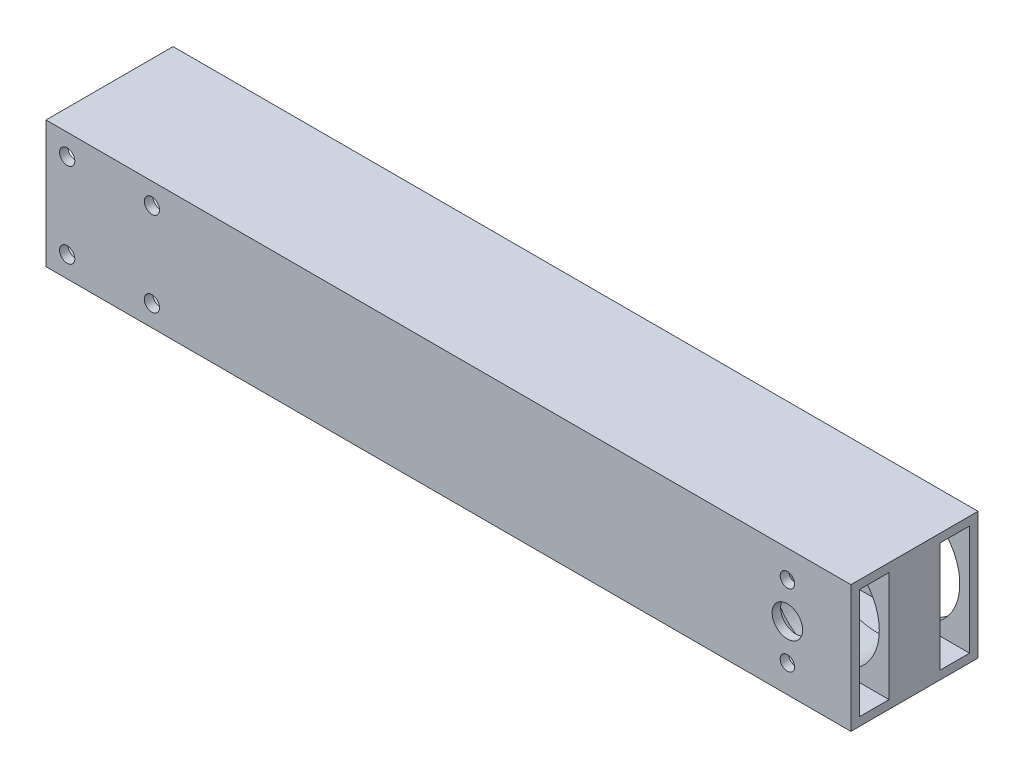
from build123d import *

# Parameters (mm, degrees)
BOSS_EXTRUDE3_DEPTH      = 110
BOSS_EXTRUDE3_DEPTH_BACK = 80
SKETCH1_W                = 30
SKETCH1_H                = 30
SKETCH1_W_2              = 7
SKETCH1_H_2              = 26
SKETCH6_R                = 12.7
CUT_EXTRUDE5_DEPTH       = 23
SKETCH8_R                = 3.6
SKETCH8_R_2              = 1.7
CUT_EXTRUDE6_DEPTH       = 17
SKETCH9_W                = 12
SKETCH9_H                = 26
CUT_EXTRUDE7_DEPTH       = 155
M3_CLEARANCE_HOLE1_D     = 3.6


with BuildPart() as part:
    # Sketch1 → Boss-Extrude3 (new, two sides: drawn at the far end of the back side and taken through both)
    with BuildSketch(Plane(origin=(0, 0, 0), x_dir=(0, 0, -1), z_dir=(1, 0, 0)).offset(-BOSS_EXTRUDE3_DEPTH_BACK)):
        Rectangle(SKETCH1_W, SKETCH1_H)
        with Locations((-9.5, 0)):
            Rectangle(SKETCH1_W_2, SKETCH1_H_2, mode=Mode.SUBTRACT)
        with Locations((9.5, 0)):
            Rectangle(SKETCH1_W_2, SKETCH1_H_2, mode=Mode.SUBTRACT)
    extrude(amount=BOSS_EXTRUDE3_DEPTH + BOSS_EXTRUDE3_DEPTH_BACK)

    # Sketch6 → Cut-Extrude5 (cut)
    with BuildSketch(Plane(origin=(0, 0, -15), x_dir=(-1, 0, 0), z_dir=(0, 0, -1))):
        with Locations((-95, 0)):
            Circle(SKETCH6_R)
    extrude(amount=-CUT_EXTRUDE5_DEPTH, mode=Mode.SUBTRACT)

    # Sketch8 → Cut-Extrude6 (cut)
    with BuildSketch(Plane.XY.offset(15)):
        with Locations((95, 0)):
            Circle(SKETCH8_R)
        with Locations((95, 8.5)):
            Circle(SKETCH8_R_2)
        with Locations((95, -8.5)):
            Circle(SKETCH8_R_2)
    extrude(amount=-CUT_EXTRUDE6_DEPTH, mode=Mode.SUBTRACT)

    # Sketch9 → Cut-Extrude7 (cut)
    with BuildSketch(Plane.ZY.offset(80)):
        Rectangle(SKETCH9_W, SKETCH9_H)
    extrude(amount=-CUT_EXTRUDE7_DEPTH, mode=Mode.SUBTRACT)

    # M3 Clearance Hole1 (through all)
    with Locations(Plane.XY.offset(15)):
        with Locations((-75, 10), (-75, -10), (-55, -10), (-55, 10)):
            Hole(M3_CLEARANCE_HOLE1_D / 2)


solid = part.part
